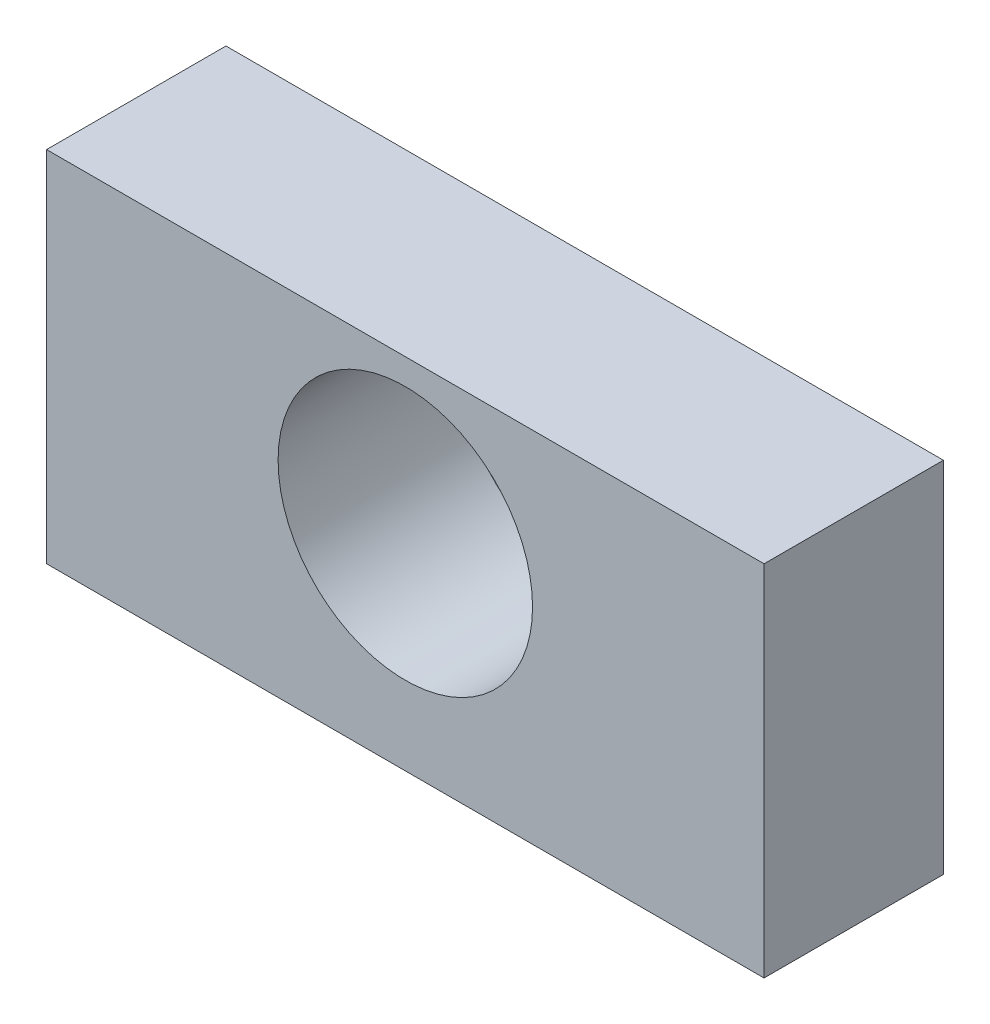
from build123d import *

# Parameters (mm, degrees)
SKETCH1_W                   = 19.05
SKETCH1_H                   = 9.525
EXTRUDE1_DEPTH              = 4.7625
F_1_4_CLEARANCE_HOLE1_D     = 6.7564
F_1_4_CLEARANCE_HOLE1_DEPTH = 15.24
F_1_4_CLEARANCE_HOLE1_TIP   = 2.029827343


with BuildPart() as part:
    # Sketch1 → Extrude1 (new body)
    with BuildSketch(Plane.XY):
        Rectangle(SKETCH1_W, SKETCH1_H)
    extrude(amount=EXTRUDE1_DEPTH)

    # 1/4 Clearance Hole1
    with Locations(Plane(origin=(0, 0.6985, 4.7625), x_dir=(1, 0, 0), z_dir=(0, 0, 1))):
        with Locations((0, 0)):
            Hole(F_1_4_CLEARANCE_HOLE1_D / 2, depth=F_1_4_CLEARANCE_HOLE1_DEPTH)
            with Locations((0, 0, -(F_1_4_CLEARANCE_HOLE1_DEPTH + F_1_4_CLEARANCE_HOLE1_TIP / 2))):  # 118° drill point
                Cone(0, F_1_4_CLEARANCE_HOLE1_D / 2, F_1_4_CLEARANCE_HOLE1_TIP, mode=Mode.SUBTRACT)


solid = part.part
